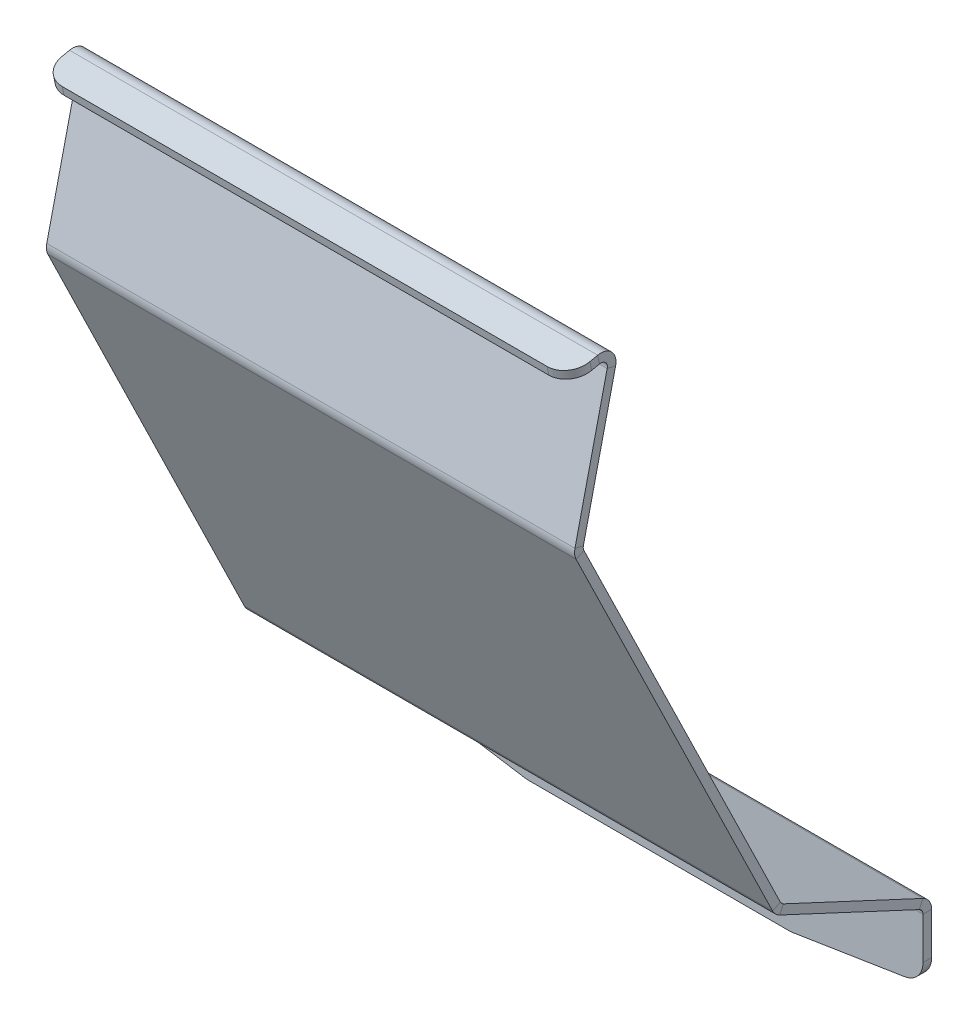
from build123d import *

# Parameters (mm, degrees)
SKETCH1_R              = 4.5
EXTRUDE1_DEPTH         = 4
PROCESS_BENDS1_START   = -122
PROCESS_BENDS1_DEPTH   = 244
PROCESS_BENDS1_2_DEPTH = 244
PROCESS_BENDS1_START_2 = 357.035547254
PROCESS_BENDS1_3_DEPTH = 4.964452746


with BuildPart() as part:
    # Sketch1 → Extrude1 (new body)
    with BuildSketch(Plane.XY):
        with BuildLine():
            Line((-60, 0), (60, 0))
            ThreePointArc((60, 0), (61.019968244, 0.040074661), (62.033648046, 0.160051572))
            Line((62.033648046, 0.160051572), (113.56434465, 8.321712114))
            ThreePointArc((113.56434465, 8.321712114), (119.604059656, 11.704115036), (122, 18.19859552))
            Line((122, 18.19859552), (122, 405))
            ThreePointArc((122, 405), (119.071067812, 412.071067812), (112, 415))
            Line((112, 415), (-112, 415))
            ThreePointArc((-112, 415), (-119.071067812, 412.071067812), (-122, 405))
            Line((-122, 405), (-122, 18.19859552))
            ThreePointArc((-122, 18.19859552), (-119.604059656, 11.704115036), (-113.56434465, 8.321712114))
            Line((-113.56434465, 8.321712114), (-62.033648046, 0.160051572))
            ThreePointArc((-62.033648046, 0.160051572), (-61.019968244, 0.040074661), (-60, 0))
        make_face()
        with Locations((60, 13)):
            Circle(SKETCH1_R, mode=Mode.SUBTRACT)
        with Locations(Location((-60, 13, 0), (0, 0, 180))):
            Circle(SKETCH1_R, mode=Mode.SUBTRACT)
    extrude(amount=EXTRUDE1_DEPTH)

    # Process-Bends1: read off the stored shape, not the designer's step
    # Process-Bends1 outline → Process-Bends1 (cut)
    with BuildSketch(Plane.YZ.offset(PROCESS_BENDS1_START)):
        with BuildLine():
            Line((415, 4), (43.866625588, 4))
            ThreePointArc((43.866625588, 4), (41.283727655, 1.083920217), (37.542070268, 0))
            Line((37.542070268, 0), (415, 0))
            Line((415, 0), (415, 4))
        make_face()
    extrude(amount=PROCESS_BENDS1_DEPTH, mode=Mode.SUBTRACT)

    # Process-Bends1 2 outline → Process-Bends1 2 (add)
    with BuildSketch(Plane.YZ.offset(PROCESS_BENDS1_START)):
        with BuildLine():
            Line((333.473997554, 167.613261682), (329.561407151, 166.781614919))
            Line((329.561407151, 166.781614919), (332.399683469, 153.428574691))
            ThreePointArc((332.399683469, 153.428574691), (331.56796846, 150.665088271), (328.790387504, 149.881729425))
            Line((328.790387504, 149.881729425), (264.309892155, 164.768224749))
            ThreePointArc((264.309892155, 164.768224749), (261.942812278, 164.902637285), (259.666636747, 164.239192619))
            Line((259.666636747, 164.239192619), (73.570894156, 73.474234364))
            ThreePointArc((73.570894156, 73.474234364), (71.646739039, 72.08904089), (70.295337674, 70.141003872))
            Line((70.295337674, 70.141003872), (40.260993629, 5.732145215))
            ThreePointArc((40.260993629, 5.732145215), (39.153969093, 4.469825663), (37.542070268, 4))
            Line((37.542070268, 4), (43.866625588, 4))
            ThreePointArc((43.866625588, 4), (43.876459451, 4.020819967), (43.886224777, 4.041672168))
            Line((43.886224777, 4.041672168), (73.920568822, 68.450530825))
            ThreePointArc((73.920568822, 68.450530825), (74.499740836, 69.285403833), (75.324378743, 69.879058179))
            Line((75.324378743, 69.879058179), (261.420121334, 160.644016434))
            ThreePointArc((261.420121334, 160.644016434), (262.395625133, 160.928349862), (263.410087937, 160.87074449))
            Line((263.410087937, 160.87074449), (327.890583287, 145.984249165))
            ThreePointArc((327.890583287, 145.984249165), (334.371605517, 147.812086475), (336.312273872, 154.260221455))
            Line((336.312273872, 154.260221455), (333.473997554, 167.613261682))
        make_face()
    extrude(amount=PROCESS_BENDS1_2_DEPTH)

    # Process-Bends1 3 outline → Process-Bends1 3 (cut)
    with BuildSketch(Plane(origin=(0, 0, 0), x_dir=(1, 0, 0), z_dir=(0, 0.9781476007338049, 0.20791169081776298)).offset(PROCESS_BENDS1_START_2)):
        with BuildLine():
            Line((-122, -94.61736709), (-112, -94.61736709))
            ThreePointArc((-112, -94.61736709), (-119.071067812, -91.688434902), (-122, -84.61736709))
            Line((-122, -84.61736709), (-122, -94.61736709))
        make_face()
        with BuildLine():
            ThreePointArc((122, -84.61736709), (119.071067812, -91.688434902), (112, -94.61736709))
            Line((112, -94.61736709), (122, -94.61736709))
            Line((122, -94.61736709), (122, -84.61736709))
        make_face()
    extrude(amount=PROCESS_BENDS1_3_DEPTH, mode=Mode.SUBTRACT)


solid = part.part
